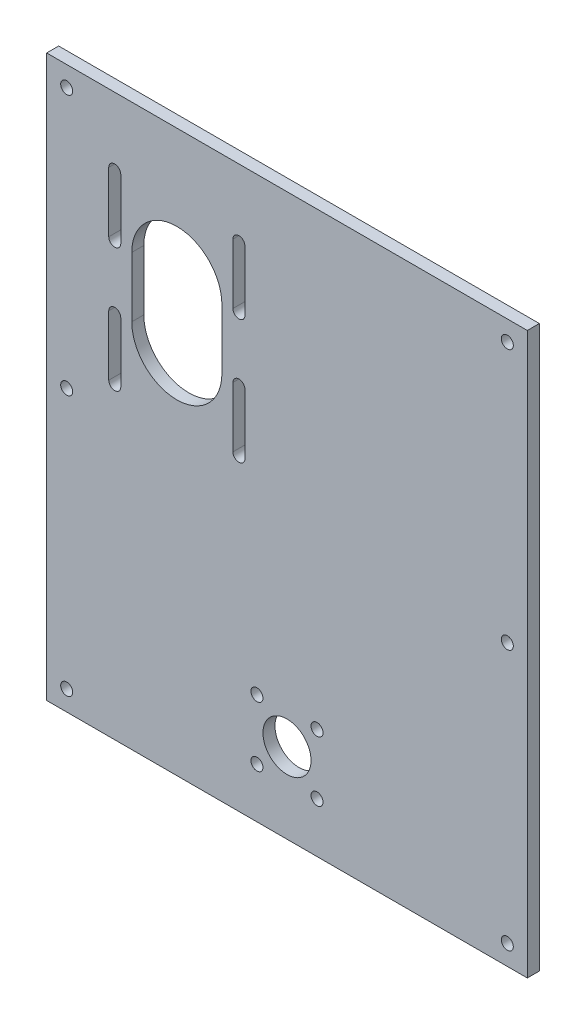
from build123d import *

# Parameters (mm, degrees)
BOSS_EXTRU_1_DEPTH      = 3
ESQUISSE2_R             = 1.5
ENL_V_MAT_EXTRU_2_DEPTH = 3
ESQUISSE3_R             = 6
ESQUISSE3_R_2           = 1.5
ENL_V_MAT_EXTRU_3_DEPTH = 10
ESQUISSE4_W             = 100
ESQUISSE4_H             = 11.457187309
ENL_V_MAT_EXTRU_4_DEPTH = 10


with BuildPart() as part:
    # Esquisse1 → Boss.-Extru.1 (new body)
    with BuildSketch(Plane.XY):
        Polygon((-50, -75), (50, -75), (50, -65), (60, -65), (60, 75), (-60, 75), (-60, -65), (-50, -65), align=None)
        with BuildLine():
            ThreePointArc((-41.5, 12), (-43, 10.5), (-44.5, 12))
            Line((-44.5, 12), (-44.5, 27))
            ThreePointArc((-44.5, 27), (-43, 28.5), (-41.5, 27))
            Line((-41.5, 27), (-41.5, 12))
        make_face(mode=Mode.SUBTRACT)
        with BuildLine():
            ThreePointArc((-16.25, 27.5), (-27.5, 16.25), (-38.75, 27.5))
            Line((-38.75, 27.5), (-38.75, 42.5))
            ThreePointArc((-38.75, 42.5), (-27.5, 53.75), (-16.25, 42.5))
            Line((-16.25, 42.5), (-16.25, 27.5))
        make_face(mode=Mode.SUBTRACT)
        with BuildLine():
            Line((-10.5, 27), (-10.5, 12))
            ThreePointArc((-10.5, 12), (-12, 10.5), (-13.5, 12))
            Line((-13.5, 12), (-13.5, 27))
            ThreePointArc((-13.5, 27), (-12, 28.5), (-10.5, 27))
        make_face(mode=Mode.SUBTRACT)
        with BuildLine():
            ThreePointArc((-41.5, 43), (-43, 41.5), (-44.5, 43))
            Line((-44.5, 43), (-44.5, 58))
            ThreePointArc((-44.5, 58), (-43, 59.5), (-41.5, 58))
            Line((-41.5, 58), (-41.5, 43))
        make_face(mode=Mode.SUBTRACT)
        with BuildLine():
            Line((-10.5, 58), (-10.5, 43))
            ThreePointArc((-10.5, 43), (-12, 41.5), (-13.5, 43))
            Line((-13.5, 43), (-13.5, 58))
            ThreePointArc((-13.5, 58), (-12, 59.5), (-10.5, 58))
        make_face(mode=Mode.SUBTRACT)
    extrude(amount=BOSS_EXTRU_1_DEPTH)

    # Esquisse2 → Enlèv. mat.-Extru.2 (cut)
    with BuildSketch(Plane.XY.offset(3)):
        with Locations((45, -70)):
            Circle(ESQUISSE2_R)
        with Locations((-55, -60)):
            Circle(ESQUISSE2_R)
        with Locations((-55, 5)):
            Circle(ESQUISSE2_R)
        with Locations((-55, 70)):
            Circle(ESQUISSE2_R)
        with Locations((22.5, -70)):
            Circle(ESQUISSE2_R)
        with Locations((0, -70)):
            Circle(ESQUISSE2_R)
        with Locations((-22.5, -70)):
            Circle(ESQUISSE2_R)
        with Locations((-45, -70)):
            Circle(ESQUISSE2_R)
        with Locations((55, -60)):
            Circle(ESQUISSE2_R)
        with Locations((55, 5)):
            Circle(ESQUISSE2_R)
        with Locations((55, 70)):
            Circle(ESQUISSE2_R)
    extrude(amount=-ENL_V_MAT_EXTRU_2_DEPTH, mode=Mode.SUBTRACT)

    # Esquisse3 → Enlèv. mat.-Extru.3 (cut)
    with BuildSketch(Plane.XY.offset(3)):
        with Locations((0, -45)):
            Circle(ESQUISSE3_R)
        with Locations((-7.5, -37.5)):
            Circle(ESQUISSE3_R_2)
        with Locations((7.5, -37.5)):
            Circle(ESQUISSE3_R_2)
        with Locations((7.5, -52.5)):
            Circle(ESQUISSE3_R_2)
        with Locations((-7.5, -52.5)):
            Circle(ESQUISSE3_R_2)
    extrude(amount=-ENL_V_MAT_EXTRU_3_DEPTH, mode=Mode.SUBTRACT)

    # Esquisse4 → Enlèv. mat.-Extru.4 (cut)
    with BuildSketch(Plane.XY.offset(3)):
        with Locations((0, -70.728593655)):
            Rectangle(ESQUISSE4_W, ESQUISSE4_H)
    extrude(amount=-ENL_V_MAT_EXTRU_4_DEPTH, mode=Mode.SUBTRACT)


solid = part.part
